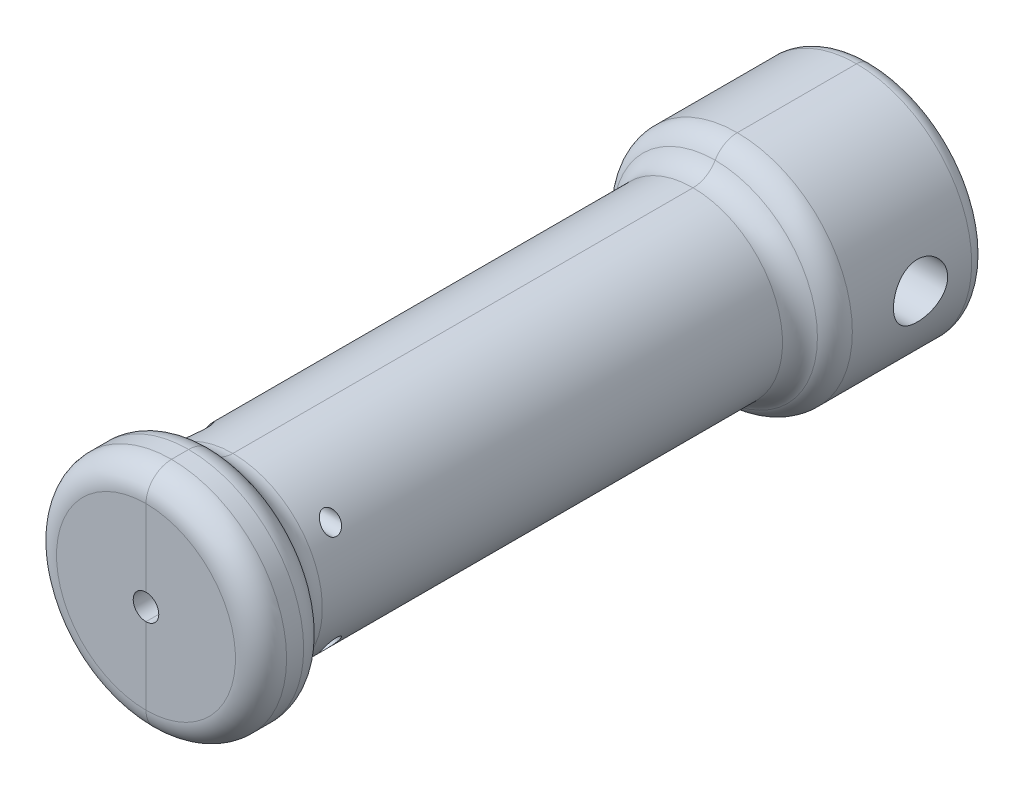
from build123d import *

# Parameters (mm, degrees)
ESQUISSE2_R                  = 22.5
BOSS_EXTRU_1_DEPTH           = 30
ESQUISSE3_R                  = 17.5
BOSS_EXTRU_2_DEPTH           = 100
ESQUISSE4_R                  = 22.5
BOSS_EXTRU_3_DEPTH           = 12
CONG_2_R                     = 5
CONG_3_R                     = 5
CONG_4_R                     = 5
CONG_5_R                     = 5
ESQUISSE5_W                  = 2.75
ESQUISSE5_H                  = 12.6
ENL_V_MAT_EXTRU_1_DEPTH      = 20
ESQUISSE6_R                  = 1.75
ENL_V_MAT_EXTRU_2_DEPTH      = 50
ESQUISSE9_R                  = 2.5
ENL_V_MAT_EXTRU_3_DEPTH      = 105
ESQUISSE10_W                 = 30
ESQUISSE10_H                 = 20
ENL_V_MAT_EXTRU_4_DEPTH      = 2.5
CONG_6_R                     = 3
ESQUISSE11_W                 = 12.839037829
ESQUISSE11_H                 = 13.148845662
ENL_V_MAT_EXTRU_5_DEPTH      = 2.5
ENL_V_MAT_EXTRU_6_DEPTH      = 150.326822904
ENL_V_MAT_EXTRU_6_DEPTH_BACK = 150.326822904
ESQUISSE12_R                 = 3.25
ESQUISSE14_R                 = 5.3
ENL_V_MAT_EXTRU_7_DEPTH      = 150.326822904
ENL_V_MAT_EXTRU_8_DEPTH      = 151.24812824
CONG_7_R                     = 3
ESQUISSE16_R                 = 10
ENL_V_MAT_EXTRU_9_DEPTH      = 8
ESQUISSE20_R                 = 4
ENL_V_MAT_EXTRU_11_DEPTH     = 149.802721878
ESQUISSE21_R                 = 1.75
ENL_V_MAT_EXTRU_12_DEPTH     = 149.802721878


with BuildPart() as part:
    # Esquisse2 → Boss.-Extru.1 (new body)
    with BuildSketch(Plane.XY.offset(2)):
        Circle(ESQUISSE2_R)
    extrude(amount=BOSS_EXTRU_1_DEPTH)

    # Esquisse3 → Boss.-Extru.2 (add)
    with BuildSketch(Plane.XY.offset(32)):
        Circle(ESQUISSE3_R)
    extrude(amount=BOSS_EXTRU_2_DEPTH)

    # Esquisse4 → Boss.-Extru.3 (add)
    with BuildSketch(Plane.XY.offset(132)):
        Circle(ESQUISSE4_R)
    extrude(amount=BOSS_EXTRU_3_DEPTH)

    # Congé2
    cong_2_edges = [part.edges().sort_by_distance(p)[0] for p in [
        (-17.5, 0, 32),
    ]]
    fillet(cong_2_edges, radius=CONG_2_R - 0.0001)  # a hair under: the kernel refuses the full size

    # Congé3
    cong_3_edges = [part.edges().sort_by_distance(p)[0] for p in [
        (-17.5, 0, 132),
    ]]
    fillet(cong_3_edges, radius=CONG_3_R - 0.0001)  # a hair under: the kernel refuses the full size

    # Congé4
    cong_4_edges = [part.edges().sort_by_distance(p)[0] for p in [
        (-22.5, 0, 144),
        (-22.5, 0, 132),
    ]]
    fillet(cong_4_edges, radius=CONG_4_R)

    # Congé5
    cong_5_edges = [part.edges().sort_by_distance(p)[0] for p in [
        (-22.5, 0, 32),
    ]]
    fillet(cong_5_edges, radius=CONG_5_R)

    # Esquisse5 → Enlèv. mat.-Extru.1 (cut)
    with BuildSketch(Plane(origin=(0, 0, 2), x_dir=(-1, 0, 0), z_dir=(0, 0, -1))):
        with Locations((-7.325, 0)):
            Rectangle(ESQUISSE5_W, ESQUISSE5_H)
    extrude(amount=-ENL_V_MAT_EXTRU_1_DEPTH, mode=Mode.SUBTRACT)

    # Esquisse6 → Enlèv. mat.-Extru.2 (cut)
    with BuildSketch(Plane(origin=(0, 0, 2), x_dir=(-1, 0, 0), z_dir=(0, 0, -1))):
        with Locations((0, 9.134603624)):
            Circle(ESQUISSE6_R)
    extrude(amount=-ENL_V_MAT_EXTRU_2_DEPTH, mode=Mode.SUBTRACT)

    # Esquisse9 → Enlèv. mat.-Extru.3 (cut)
    with BuildSketch(Plane.XY.offset(144)):
        Circle(ESQUISSE9_R)
    extrude(amount=-ENL_V_MAT_EXTRU_3_DEPTH, mode=Mode.SUBTRACT)

    # Esquisse10 → Enlèv. mat.-Extru.4 (cut, symmetric)
    with BuildSketch(Plane(origin=(0, 0, 0), x_dir=(0, 0, -1), z_dir=(1, 0, 0))):
        with Locations((-76.021139795, 0)):
            Rectangle(ESQUISSE10_W, ESQUISSE10_H)
    extrude(amount=ENL_V_MAT_EXTRU_4_DEPTH, both=True, mode=Mode.SUBTRACT)

    # Congé6
    cong_6_edges = [part.edges().sort_by_distance(p)[0] for p in [
        (0, 10, 61.021139795),
        (0, -10, 91.021139795),
        (0, -10, 61.021139795),
        (0, 10, 91.021139795),
    ]]
    fillet(cong_6_edges, radius=CONG_6_R)

    # Esquisse11 → Enlèv. mat.-Extru.5 (cut, symmetric)
    with BuildSketch(Plane(origin=(0, 0, 0), x_dir=(0, 0, -1), z_dir=(1, 0, 0))):
        with Locations((-45.504342122, 4.0918417)):
            Rectangle(ESQUISSE11_W, ESQUISSE11_H)
    extrude(amount=ENL_V_MAT_EXTRU_5_DEPTH, both=True, mode=Mode.SUBTRACT)

    # Esquisse12 → Enlèv. mat.-Extru.6 (cut, two sides: drawn at the far end of the back side and taken through both)
    with BuildSketch(Plane(origin=(10, 0, 0), x_dir=(0, 0, -1), z_dir=(1, 0, 0)).offset(-ENL_V_MAT_EXTRU_6_DEPTH_BACK)):
        with Locations((-15, 0)):
            Circle(ESQUISSE12_R)
    extrude(amount=ENL_V_MAT_EXTRU_6_DEPTH + ENL_V_MAT_EXTRU_6_DEPTH_BACK, mode=Mode.SUBTRACT)

    # Esquisse14 → Enlèv. mat.-Extru.7 (cut, through all)
    with BuildSketch(Plane(origin=(10, 0, 0), x_dir=(0, 0, -1), z_dir=(1, 0, 0))):
        with Locations(Location((-15, 0, 0), (0, 0, 180))):
            Circle(ESQUISSE14_R)
    extrude(amount=ENL_V_MAT_EXTRU_7_DEPTH, mode=Mode.SUBTRACT)

    # Esquisse15 → Enlèv. mat.-Extru.8 (cut, through all)
    with BuildSketch(Plane(origin=(-14, 0, 0), x_dir=(0, 0, -1), z_dir=(1, 0, 0))):
        Polygon((-20.990556739, 0.408121656), (-18.348722092, -4.983913491), (-12.358165353, -5.392035147), (-9.009443261, -0.408121656), (-11.651277908, 4.983913491), (-17.641834647, 5.392035147), align=None)
    extrude(amount=-ENL_V_MAT_EXTRU_8_DEPTH, mode=Mode.SUBTRACT)

    # Congé7
    cong_7_edges = [part.edges().sort_by_distance(p)[0] for p in [
        (-22.5, 0, 2),
    ]]
    fillet(cong_7_edges, radius=CONG_7_R)

    # Esquisse16 → Enlèv. mat.-Extru.9 (cut)
    with BuildSketch(Plane.XY.offset(114)):
        Circle(ESQUISSE16_R)
    extrude(amount=-ENL_V_MAT_EXTRU_9_DEPTH, mode=Mode.SUBTRACT)

    # Esquisse20 → Enlèv. mat.-Extru.11 (cut, through all)
    with BuildSketch(Plane(origin=(-7.5, 0, 0), x_dir=(0, 0, -1), z_dir=(1, 0, 0))):
        with Locations((-122, 10.322063384)):
            Circle(ESQUISSE20_R)
        with Locations((-122, -10.322063384)):
            Circle(ESQUISSE20_R)
    extrude(amount=-ENL_V_MAT_EXTRU_11_DEPTH, mode=Mode.SUBTRACT)

    # Esquisse21 → Enlèv. mat.-Extru.12 (cut, through all)
    with BuildSketch(Plane.ZY.offset(7.5)):
        with Locations((122, -10.322063384)):
            Circle(ESQUISSE21_R)
        with Locations((122, 10.322063384)):
            Circle(ESQUISSE21_R)
    extrude(amount=-ENL_V_MAT_EXTRU_12_DEPTH, mode=Mode.SUBTRACT)


with BuildPart() as body_2:
    # Fractionner1: the piece on the far side of the plane
    add(part.part)
    split(bisect_by=Plane(origin=(0, 0, 0), x_dir=(0, 0, 1), z_dir=(1, 0, 0)), keep=Keep.BOTTOM)


with BuildPart() as part_1:
    add(part.part)

    # Fractionner1
    split(bisect_by=Plane(origin=(0, 0, 0), x_dir=(0, 0, 1), z_dir=(1, 0, 0)), keep=Keep.TOP)


solid = Compound([body_2.part, part_1.part])
